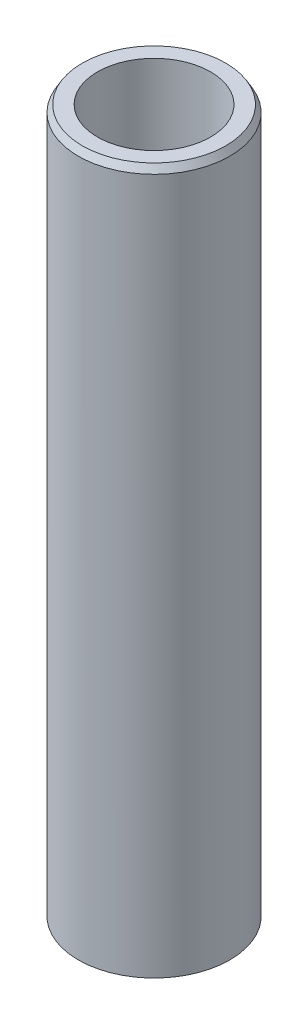
from build123d import *
from OCP.BRepFilletAPI import BRepFilletAPI_MakeChamfer

# Parameters (mm, degrees)
SKETCH1_R           = 52.5
BOSS_EXTRUDE1_DEPTH = 490.110721857
SKETCH2_R           = 39.193098191
CUT_EXTRUDE1_DEPTH  = 496.702551617
CHAMFER1_SIZE       = 4.852417385
CHAMFER1_SIZE2      = 2.801544483


with BuildPart() as part:
    # Sketch1 → Boss-Extrude1 (new body)
    with BuildSketch(Plane(origin=(0, 0, 0), x_dir=(1, 0, 0), z_dir=(0, 1, 0))):
        Circle(SKETCH1_R)
    extrude(amount=BOSS_EXTRUDE1_DEPTH)

    # Sketch2 → Cut-Extrude1 (cut, through all)
    with BuildSketch(Plane(origin=(0, 0, 0), x_dir=(1, 0, 0), z_dir=(0, 1, 0))):
        Circle(SKETCH2_R)
    extrude(amount=CUT_EXTRUDE1_DEPTH, mode=Mode.SUBTRACT)

    # Chamfer1: one chamfer whose edges measure the first distance from different faces: ONE call of the kernel's chamfer builder (chamfer() names one face for all edges)
    chamfer1_edges_1 = [part.edges().sort_by_distance(p)[0] for p in [
        (-52.5, 490.110721857, 0),
    ]]
    chamfer1_side_1 = [part.faces().sort_by_distance(p)[0] for p in [
        (-52.5, 245.055360929, 0),
    ]]
    chamfer1_edges_2 = [part.edges().sort_by_distance(p)[0] for p in [
        (-52.5, 0, 0),
    ]]
    chamfer1_side_2 = [part.faces().sort_by_distance(p)[0] for p in [
        (-51.01507576, 0, 0),
    ]]
    chamfer1 = BRepFilletAPI_MakeChamfer(part.part.solid().wrapped)
    for e in chamfer1_edges_1:
        chamfer1.Add(CHAMFER1_SIZE, CHAMFER1_SIZE2, e.wrapped, chamfer1_side_1[0].wrapped)  # the first distance lies on this face
    for e in chamfer1_edges_2:
        chamfer1.Add(CHAMFER1_SIZE, CHAMFER1_SIZE2, e.wrapped, chamfer1_side_2[0].wrapped)  # the first distance lies on this face
    add(Compound.cast(chamfer1.Shape()), mode=Mode.REPLACE)


solid = part.part
